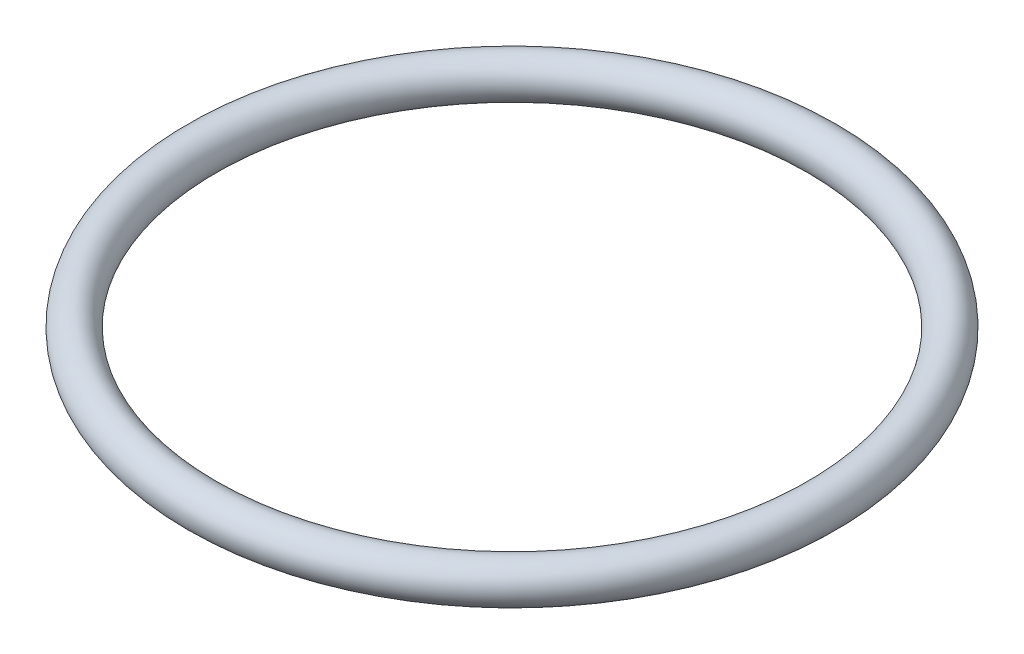
from build123d import *

# Parameters (mm, degrees)
SKETCH1_R = 1.25


with BuildPart() as part:
    # Sketch1 → Revolve1 (revolve)
    with BuildSketch(Plane.XY):
        with Locations((-19.45, 0)):
            Circle(SKETCH1_R)
    revolve(axis=Axis((0, 0, 0), (0, 1, 0)))


solid = part.part
